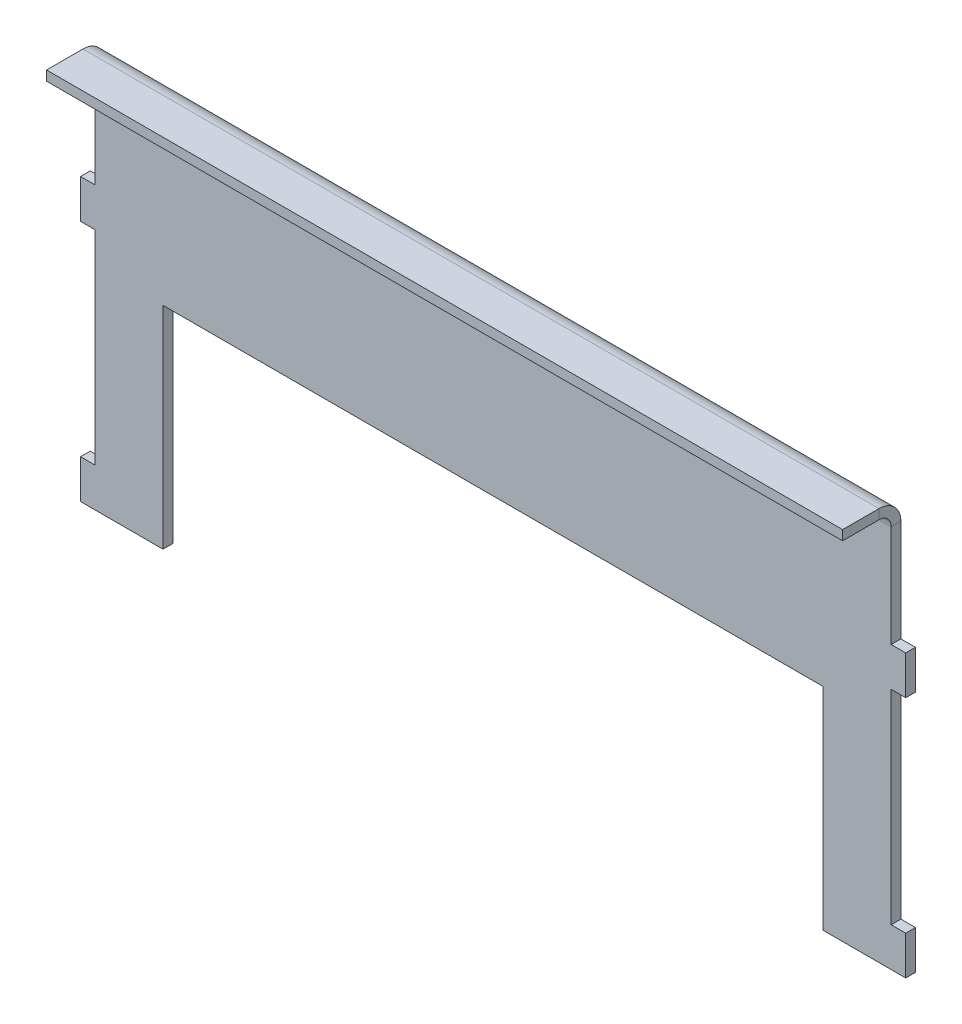
from build123d import *

# Parameters (mm, degrees)
BASE_FLANGE1_DEPTH           = 6.35
EDGE_FLANGE1_STRIP_W         = 41.3004
EDGE_FLANGE1_STRIP_H         = 6.35
EDGE_FLANGE1_STRIP_CUT_DEPTH = 520.7
EDGE_FLANGE1_DEPTH           = 520.7


# Sheet-metal steps are written as plain solids
with BuildPart() as part:
    # Sketch1 → Base-Flange1 (new body)
    with BuildSketch(Plane.XY):
        Polygon((-260.35, 127), (260.35, 127), (260.35, 46.0375), (269.875, 46.0375), (269.875, 20.6375), (260.35, 20.6375), (260.35, -112.7125), (269.875, -112.7125), (269.875, -138.1125), (215.9, -138.1125), (215.9, 0), (-215.9, 0), (-215.9, -138.1125), (-269.875, -138.1125), (-269.875, -112.7125), (-260.35, -112.7125), (-260.35, 20.6375), (-269.875, 20.6375), (-269.875, 46.0375), (-260.35, 46.0375), align=None)
    extrude(amount=-BASE_FLANGE1_DEPTH)

    # Edge-Flange1 strip (across the edge) → Edge-Flange1 strip cut (cut)
    with BuildSketch(Plane(origin=(260.35, 127, 0), x_dir=(0, -1, 0), z_dir=(-1, 0, 0))):
        with Locations((-6.35, -3.175)):
            Rectangle(EDGE_FLANGE1_STRIP_W, EDGE_FLANGE1_STRIP_H)
    extrude(amount=EDGE_FLANGE1_STRIP_CUT_DEPTH, mode=Mode.SUBTRACT)

    # Edge-Flange1 section (across the edge) → Edge-Flange1 (add)
    with BuildSketch(Plane(origin=(260.35, 127, 0), x_dir=(0, -1, 0), z_dir=(-1, 0, 0))):
        with BuildLine():
            Line((0, 7.9502), (0, 31.75))
            Line((0, 31.75), (6.35, 31.75))
            Line((6.35, 31.75), (6.35, 7.9502))
            ThreePointArc((6.35, 7.9502), (8.678559668, 2.328559668), (14.3002, 0))
            Line((14.3002, 0), (14.3002, -6.35))
            ThreePointArc((14.3002, -6.35), (4.188431608, -2.161568392), (0, 7.9502))
        make_face()
    extrude(amount=EDGE_FLANGE1_DEPTH)


solid = part.part
